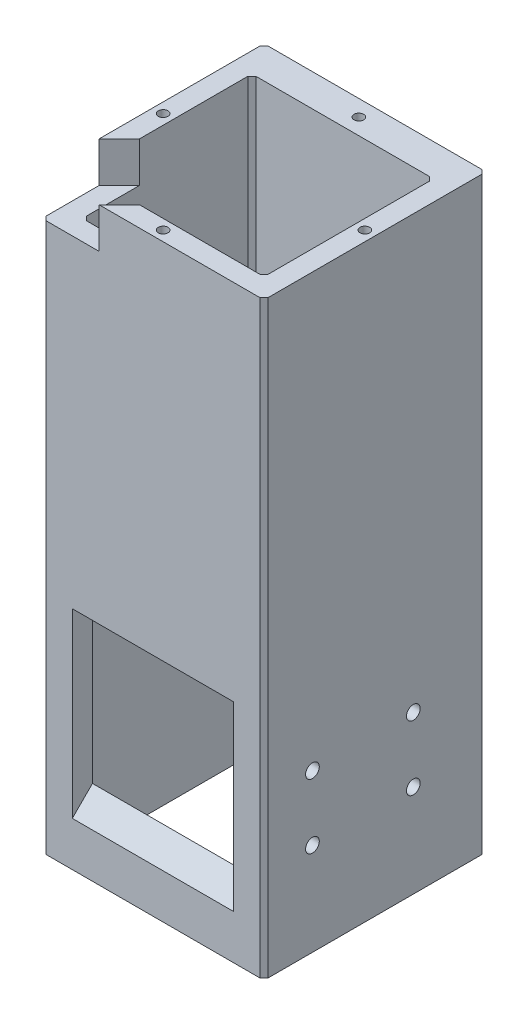
from build123d import *

# Parameters (mm, degrees)
BOSS_EXTRUDE1_DEPTH                             = 130
BOSS_EXTRUDE1_DEPTH_BACK                        = 16
SKETCH1_W                                       = 55
SKETCH1_H                                       = 55
SKETCH1_W_2                                     = 45
SKETCH1_H_2                                     = 42
SKETCH2_W                                       = 40
SKETCH2_H                                       = 35
CUT_EXTRUDE1_DEPTH                              = 168
CUT_EXTRUDE2_DEPTH                              = 10
SKETCH8_W                                       = 25
SKETCH8_H                                       = 8
CUT_EXTRUDE5_DEPTH                              = 5
CSK_FOR_M2_FLAT_HEAD_MACHINE_SCREW2_D           = 2.4
CSK_FOR_M2_FLAT_HEAD_MACHINE_SCREW2_DEPTH       = 9.278967257
CSK_FOR_M2_FLAT_HEAD_MACHINE_SCREW2_CSINK_D     = 4.4
CSK_FOR_M2_FLAT_HEAD_MACHINE_SCREW2_CSINK_ANGLE = 90
CSK_FOR_M2_FLAT_HEAD_MACHINE_SCREW2_TIP         = 0.721032743
CHAMFER1_SIZE                                   = 1
CHAMFER3_SIZE                                   = 1
CUT_EXTRUDE6_REACH                              = 153.131
SKETCH11_W                                      = 20
SKETCH11_H                                      = 10
CUT_EXTRUDE7_REACH                              = 145.81
SKETCH12_R                                      = 1.7
CHAMFER2_SIZE                                   = 5
SKETCH13_R                                      = 1.2
CUT_EXTRUDE8_DEPTH                              = 10


with BuildPart() as part:
    # Sketch1 → Boss-Extrude1 (new, two sides: drawn at the far end of the back side and taken through both)
    with BuildSketch(Plane(origin=(0, 0, 0), x_dir=(1, 0, 0), z_dir=(0, 1, 0)).offset(-BOSS_EXTRUDE1_DEPTH_BACK)):
        Rectangle(SKETCH1_W, SKETCH1_H)
        with Locations((0, -1.5)):
            Rectangle(SKETCH1_W_2, SKETCH1_H_2, mode=Mode.SUBTRACT)
    extrude(amount=BOSS_EXTRUDE1_DEPTH + BOSS_EXTRUDE1_DEPTH_BACK)

    # Sketch2 → Cut-Extrude1 (cut)
    with BuildSketch(Plane.XY.offset(27.5)):
        with Locations((0, 17.5)):
            Rectangle(SKETCH2_W, SKETCH2_H)
    extrude(amount=-CUT_EXTRUDE1_DEPTH, mode=Mode.SUBTRACT)

    # Sketch7 → Cut-Extrude2 (cut)
    with BuildSketch(Plane(origin=(0, 0, -27.5), x_dir=(-1, 0, 0), z_dir=(0, 0, -1))):
        Polygon((19.5, 41.7), (22.5, 44.7), (22.5, 78.7), (19.5, 81.7), (-19.5, 81.7), (-22.5, 78.7), (-22.5, 44.7), (-19.5, 41.7), align=None)
    extrude(amount=-CUT_EXTRUDE2_DEPTH, mode=Mode.SUBTRACT)

    # Sketch8 → Cut-Extrude5 (cut)
    with BuildSketch(Plane.XZ.offset(-81.7)):
        with Locations((0, -23.5)):
            Rectangle(SKETCH8_W, SKETCH8_H)
    extrude(amount=-CUT_EXTRUDE5_DEPTH, mode=Mode.SUBTRACT)

    # CSK for M2 Flat Head Machine Screw2
    with Locations(Plane(origin=(0, 86.7, 0), x_dir=(-1, 0, 0), z_dir=(0, -1, 0))):
        with Locations((-5.5, 23.5), (5.5, 23.5)):
            CounterSinkHole(CSK_FOR_M2_FLAT_HEAD_MACHINE_SCREW2_D / 2, CSK_FOR_M2_FLAT_HEAD_MACHINE_SCREW2_CSINK_D / 2, depth=CSK_FOR_M2_FLAT_HEAD_MACHINE_SCREW2_DEPTH, counter_sink_angle=CSK_FOR_M2_FLAT_HEAD_MACHINE_SCREW2_CSINK_ANGLE)
            with Locations((0, 0, -(CSK_FOR_M2_FLAT_HEAD_MACHINE_SCREW2_DEPTH + CSK_FOR_M2_FLAT_HEAD_MACHINE_SCREW2_TIP / 2))):  # 118° drill point
                Cone(0, CSK_FOR_M2_FLAT_HEAD_MACHINE_SCREW2_D / 2, CSK_FOR_M2_FLAT_HEAD_MACHINE_SCREW2_TIP, mode=Mode.SUBTRACT)

    # Chamfer1
    chamfer1_edges = [part.edges().sort_by_distance(p)[0] for p in [
        (-22.5, 57, 22.5),
        (22.5, 57, 22.5),
        (22.5, 14.35, -19.5),
        (-22.5, 14.35, -19.5),
        (22.5, 104.35, -19.5),
        (-22.5, 104.35, -19.5),
    ]]
    chamfer(chamfer1_edges, length=CHAMFER1_SIZE)

    # Chamfer3
    chamfer3_edges = [part.edges().sort_by_distance(p)[0] for p in [
        (27.5, 57, 27.5),
        (-27.5, 57, 27.5),
        (-27.5, 57, -27.5),
        (27.5, 57, -27.5),
    ]]
    chamfer(chamfer3_edges, length=CHAMFER3_SIZE)

    # Sketch11 → Cut-Extrude6 (cut, up to next)
    with BuildSketch(Plane(origin=(-27, 0, 27), x_dir=(0.7071067811865475, 0, 0.7071067811865477), z_dir=(-0.7071067811865477, 0, 0.7071067811865475)), mode=Mode.PRIVATE) as cut_extrude6_sk1:
        with Locations((0, 125)):
            Rectangle(SKETCH11_W, SKETCH11_H)
    cut_extrude6_tool1 = extrude(cut_extrude6_sk1.sketch, amount=-CUT_EXTRUDE6_REACH, mode=Mode.PRIVATE) & part.part
    add(cut_extrude6_tool1.solids().sort_by_distance((-27, 125, 27))[0], mode=Mode.SUBTRACT)

    # Sketch12 → Cut-Extrude7 (cut, up to next)
    with BuildSketch(Plane(origin=(27.5, 0, 0), x_dir=(0, 0, -1), z_dir=(1, 0, 0)), mode=Mode.PRIVATE) as cut_extrude7_sk1:
        with Locations((9.5, 7)):
            Circle(SKETCH12_R)
    cut_extrude7_tool1 = extrude(cut_extrude7_sk1.sketch, amount=-CUT_EXTRUDE7_REACH, mode=Mode.PRIVATE) & part.part
    # Sketch12 → Cut-Extrude7 (cut, up to next)
    with BuildSketch(Plane(origin=(27.5, 0, 0), x_dir=(0, 0, -1), z_dir=(1, 0, 0)), mode=Mode.PRIVATE) as cut_extrude7_sk2:
        with Locations((-15.5, 7)):
            Circle(SKETCH12_R)
    cut_extrude7_tool2 = extrude(cut_extrude7_sk2.sketch, amount=-CUT_EXTRUDE7_REACH, mode=Mode.PRIVATE) & part.part
    # Sketch12 → Cut-Extrude7 (cut, up to next)
    with BuildSketch(Plane(origin=(27.5, 0, 0), x_dir=(0, 0, -1), z_dir=(1, 0, 0)), mode=Mode.PRIVATE) as cut_extrude7_sk3:
        with Locations((-15.5, 23)):
            Circle(SKETCH12_R)
    cut_extrude7_tool3 = extrude(cut_extrude7_sk3.sketch, amount=-CUT_EXTRUDE7_REACH, mode=Mode.PRIVATE) & part.part
    # Sketch12 → Cut-Extrude7 (cut, up to next)
    with BuildSketch(Plane(origin=(27.5, 0, 0), x_dir=(0, 0, -1), z_dir=(1, 0, 0)), mode=Mode.PRIVATE) as cut_extrude7_sk4:
        with Locations((9.5, 23)):
            Circle(SKETCH12_R)
    cut_extrude7_tool4 = extrude(cut_extrude7_sk4.sketch, amount=-CUT_EXTRUDE7_REACH, mode=Mode.PRIVATE) & part.part
    add(cut_extrude7_tool1.solids().sort_by_distance((27.5, 7, -9.5))[0], mode=Mode.SUBTRACT)
    add(cut_extrude7_tool2.solids().sort_by_distance((27.5, 7, 15.5))[0], mode=Mode.SUBTRACT)
    add(cut_extrude7_tool3.solids().sort_by_distance((27.5, 23, 15.5))[0], mode=Mode.SUBTRACT)
    add(cut_extrude7_tool4.solids().sort_by_distance((27.5, 23, -9.5))[0], mode=Mode.SUBTRACT)

    # Chamfer2
    chamfer2_edges = [part.edges().sort_by_distance(p)[0] for p in [
        (0, 35, -27.5),
        (0, 0, -27.5),
        (0, 35, 27.5),
        (0, 0, 27.5),
    ]]
    chamfer(chamfer2_edges, length=CHAMFER2_SIZE - 0.0001)  # a hair under: the kernel refuses the full size

    # Sketch13 → Cut-Extrude8 (cut)
    with BuildSketch(Plane(origin=(0, 130, 0), x_dir=(1, 0, 0), z_dir=(0, 1, 0))):
        with Locations(Location((0, 23.5, 0), (0, 0, 270))):
            Circle(SKETCH13_R)
        with Locations(Location((0, -25, 0), (0, 0, 270))):
            Circle(SKETCH13_R)
        with Locations(Location((25, 0, 0), (0, 0, 270))):
            Circle(SKETCH13_R)
        with Locations(Location((-25, 0, 0), (0, 0, 270))):
            Circle(SKETCH13_R)
    extrude(amount=-CUT_EXTRUDE8_DEPTH, mode=Mode.SUBTRACT)


solid = part.part
